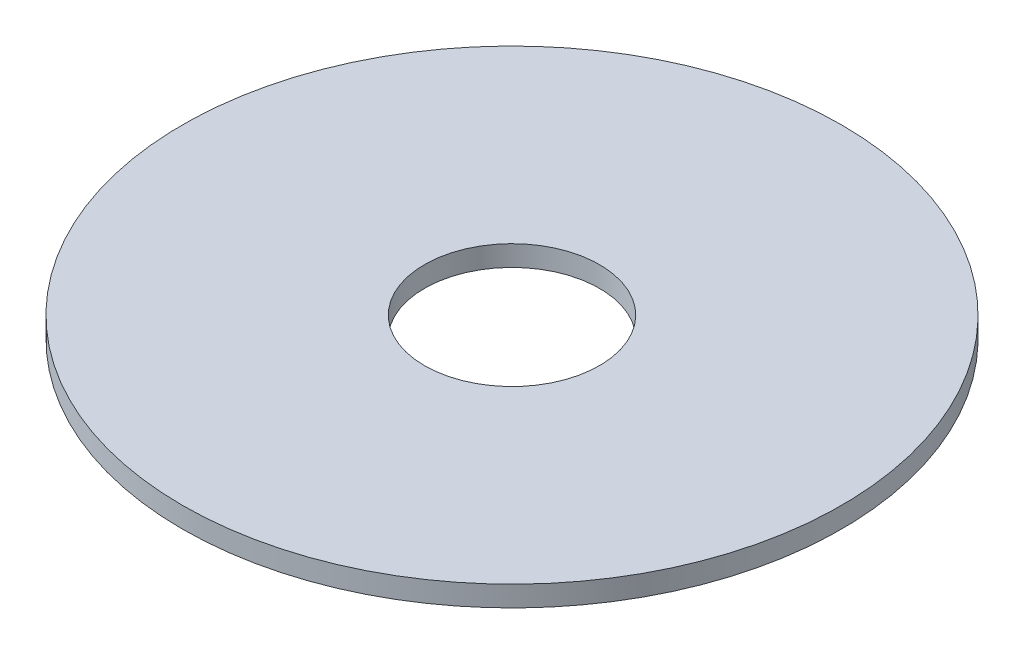
from build123d import *

# Parameters (mm, degrees)
SKETCH1_R                         = 25.4
BOSS_EXTRUDE1_DEPTH               = 1.5875
F_1_2_CLEARANCE_HOLE1_D           = 13.49248
F_1_2_CLEARANCE_HOLE1_ON_FACE_2_D = 13.49248


with BuildPart() as part:
    # Sketch1 → Boss-Extrude1 (new body)
    with BuildSketch(Plane(origin=(0, 0, 0), x_dir=(1, 0, 0), z_dir=(0, 1, 0))):
        Circle(SKETCH1_R)
    extrude(amount=BOSS_EXTRUDE1_DEPTH)

    # 1/2 Clearance Hole1 (through all)
    with Locations(Plane(origin=(0, 0, 0), x_dir=(0, 0, -1), z_dir=(0, -1, 0))):
        with Locations((0, 0)):
            Hole(F_1_2_CLEARANCE_HOLE1_D / 2)

    # 1/2 Clearance Hole1 on face 2 (through all)
    with Locations(Plane.ZX.offset(1.5875)):
        with Locations((0, 0)):
            Hole(F_1_2_CLEARANCE_HOLE1_ON_FACE_2_D / 2)


solid = part.part
